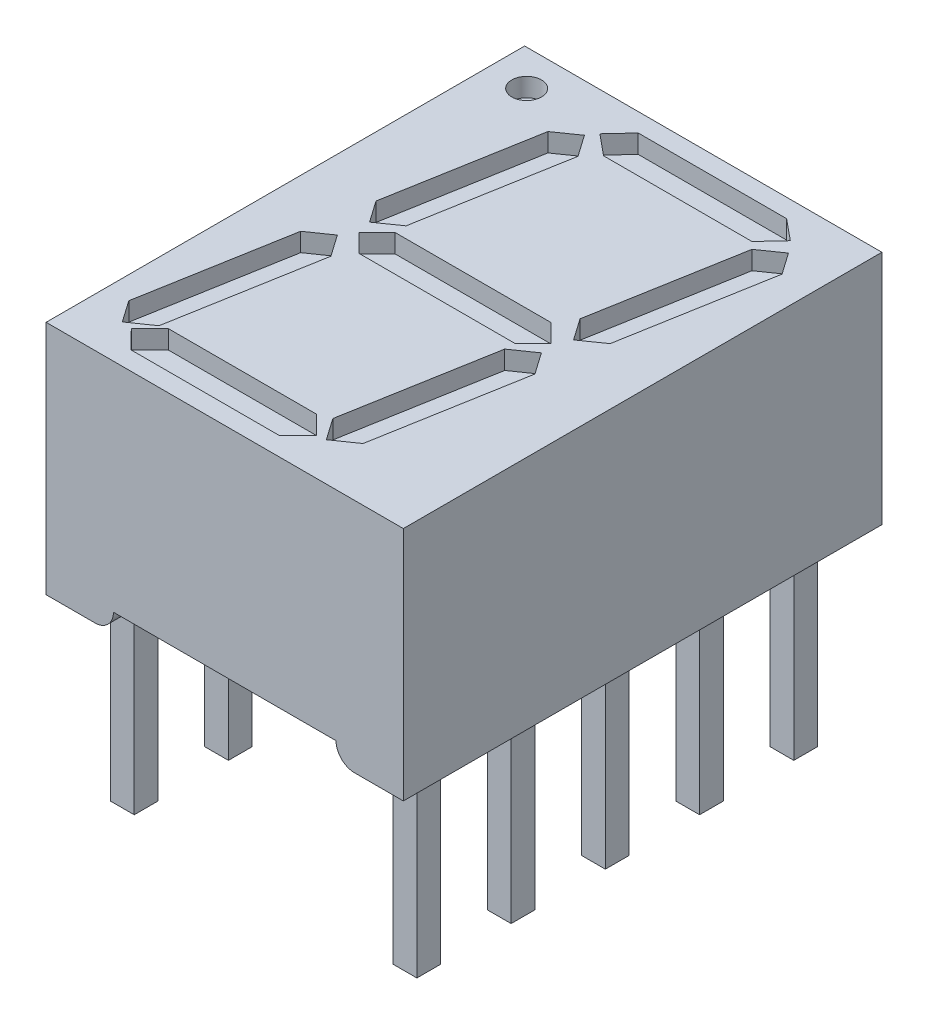
from build123d import *

# Parameters (mm, degrees)
SKETCH1_W           = 9.63
SKETCH1_H           = 12.9
BOSS_EXTRUDE1_DEPTH = 6.36
SKETCH2_W           = 6
SKETCH2_H           = 12.9
CUT_EXTRUDE1_DEPTH  = 0.5
FILLET1_R           = 0.5
SKETCH3_W           = 0.64
SKETCH3_H           = 0.64
BOSS_EXTRUDE2_DEPTH = 5
SKETCH4_R           = 0.4
CUT_EXTRUDE2_DEPTH  = 0.5


with BuildPart() as part:
    # Sketch1 → Boss-Extrude1 (new body)
    with BuildSketch(Plane(origin=(0, 0, 0), x_dir=(1, 0, 0), z_dir=(0, 1, 0))):
        Rectangle(SKETCH1_W, SKETCH1_H)
    extrude(amount=BOSS_EXTRUDE1_DEPTH)

    # Sketch2 → Cut-Extrude1 (cut)
    with BuildSketch(Plane.XZ):
        Rectangle(SKETCH2_W, SKETCH2_H)
    extrude(amount=-CUT_EXTRUDE1_DEPTH, mode=Mode.SUBTRACT)

    # Fillet1
    fillet1_edges = [part.edges().sort_by_distance(p)[0] for p in [
        (3, 0, 0),
        (-3, 0, 0),
    ]]
    fillet(fillet1_edges, radius=FILLET1_R - 0.0001)  # a hair under: the kernel refuses the full size

    # Sketch3 → Boss-Extrude2 (add)
    with BuildSketch(Plane.XZ):
        with Locations((-3.81, 2.54)):
            Rectangle(SKETCH3_W, SKETCH3_H)
        with Locations((-3.81, 5.08)):
            Rectangle(SKETCH3_W, SKETCH3_H)
        with Locations((-3.81, 0)):
            Rectangle(SKETCH3_W, SKETCH3_H)
        with Locations((-3.81, -2.54)):
            Rectangle(SKETCH3_W, SKETCH3_H)
        with Locations((-3.81, -5.08)):
            Rectangle(SKETCH3_W, SKETCH3_H)
        with Locations((3.81, 2.54)):
            Rectangle(SKETCH3_W, SKETCH3_H)
        with Locations((3.81, 5.08)):
            Rectangle(SKETCH3_W, SKETCH3_H)
        with Locations((3.81, 0)):
            Rectangle(SKETCH3_W, SKETCH3_H)
        with Locations((3.81, -2.54)):
            Rectangle(SKETCH3_W, SKETCH3_H)
        with Locations((3.81, -5.08)):
            Rectangle(SKETCH3_W, SKETCH3_H)
    extrude(amount=BOSS_EXTRUDE2_DEPTH)

    # Sketch4 → Cut-Extrude2 (cut)
    with BuildSketch(Plane(origin=(0, 6.36, 0), x_dir=(1, 0, 0), z_dir=(0, 1, 0))):
        with Locations(Location((-3.796432961, 5.485774113, 0), (0, 0, 270))):
            Circle(SKETCH4_R)
        Polygon((3.97982075, 4.592848347), (3.28522804, 0.653617335), (2.706000074, 0.248037547), (2.300420287, 0.827265513), (2.995012997, 4.766496525), (3.574240963, 5.172076312), align=None)
        Polygon((2.981343729, -1.069796233), (2.286751018, -5.009027245), (1.703567039, -5.41390948), (1.296354761, -4.832350077), (1.990947472, -0.893119065), (2.574131451, -0.48823683), align=None)
        Polygon((-3.021593907, -4.95), (0.978406093, -4.95), (1.476350329, -5.45), (0.978406093, -5.95), (-3.021593907, -5.95), (-3.519538144, -5.45), align=None)
        Polygon((-2.208030846, 0.350112276), (1.991969154, 0.350112276), (2.477076686, -0.136998017), (1.991969154, -0.62410831), (-2.208030846, -0.62410831), (-2.693138379, -0.136998017), align=None)
        Polygon((-1.254148002, 5.95), (2.745851998, 5.95), (3.31109238, 5.485774113), (2.813148144, 4.95), (-1.186851856, 4.95), (-1.752092238, 5.414225887), align=None)
        Polygon((-2.518656271, -1.069796233), (-3.213248982, -5.009027245), (-3.796432961, -5.41390948), (-4.203645239, -4.832350077), (-3.509052528, -0.893119065), (-2.925868549, -0.48823683), align=None)
        Polygon((-1.925759037, 5.172076312), (-1.52017925, 4.592848347), (-2.21477196, 0.653617335), (-2.793999926, 0.248037547), (-3.199579713, 0.827265513), (-2.504987003, 4.766496525), align=None)
    extrude(amount=-CUT_EXTRUDE2_DEPTH, mode=Mode.SUBTRACT)


solid = part.part
